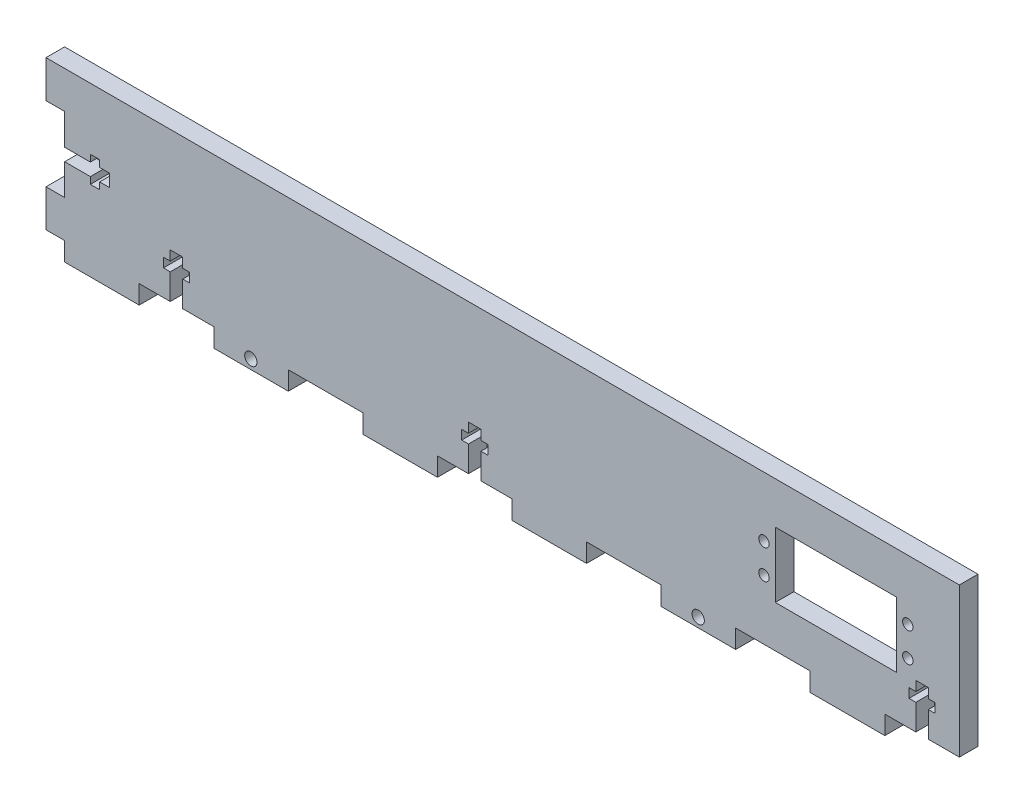
from build123d import *

# Parameters (mm, degrees)
SKETCH1_W           = 304.8
SKETCH1_H           = 50.8
BOSS_EXTRUDE1_DEPTH = 6.35
SKETCH2_W           = 41.275
SKETCH2_H           = 22.225
CUT_EXTRUDE1_DEPTH  = 265.034300402
SKETCH5_W           = 25.4
SKETCH5_H           = 6.35
BOSS_EXTRUDE2_DEPTH = 6.35
LPATTERN1_COUNT     = 6
LPATTERN1_PITCH     = 50.8
SKETCH6_W           = 6.35
SKETCH6_H           = 12.7
BOSS_EXTRUDE3_DEPTH = 6.35
LPATTERN2_COUNT     = 2
LPATTERN2_PITCH     = 38.1
CUT_EXTRUDE2_DEPTH  = 272.024068837
CUT_EXTRUDE3_DEPTH  = 272.024068837
SKETCH9_R           = 2.0955
CUT_EXTRUDE4_DEPTH  = 272.024068837
SKETCH10_R          = 1.778
CUT_EXTRUDE5_DEPTH  = 272.024068837


with BuildPart() as part:
    # Sketch1 → Boss-Extrude1 (new body)
    with BuildSketch(Plane.XY):
        with Locations((-110.333, 0)):
            Rectangle(SKETCH1_W, SKETCH1_H)
    extrude(amount=BOSS_EXTRUDE1_DEPTH)

    # Sketch2 → Cut-Extrude1 (cut, through all)
    with BuildSketch(Plane.XY.offset(6.35)):
        Rectangle(SKETCH2_W, SKETCH2_H)
    extrude(amount=-CUT_EXTRUDE1_DEPTH, mode=Mode.SUBTRACT)

    # Sketch5 → Boss-Extrude2 (add)
    with BuildSketch(Plane.XZ.offset(25.4)):
        with Locations((3.967, 3.175)):
            Rectangle(SKETCH5_W, SKETCH5_H)
    boss_extrude2 = extrude(amount=BOSS_EXTRUDE2_DEPTH)

    # LPattern1: Boss-Extrude2 ×6
    with Locations(*[(-i * LPATTERN1_PITCH, 0, 0) for i in range(1, LPATTERN1_COUNT)]):
        add(boss_extrude2)

    # Sketch6 → Boss-Extrude3 (add)
    with BuildSketch(Plane.ZY.offset(262.733)):
        with Locations((3.175, 19.05)):
            Rectangle(SKETCH6_W, SKETCH6_H)
    boss_extrude3 = extrude(amount=BOSS_EXTRUDE3_DEPTH)

    # LPattern2: Boss-Extrude3 ×2
    with Locations(*[(0, -i * LPATTERN2_PITCH, 0) for i in range(1, LPATTERN2_COUNT)]):
        add(boss_extrude3)

    # Sketch7 → Cut-Extrude2 (cut, through all)
    with BuildSketch(Plane.XY.offset(6.35)):
        Polygon((-262.733, 2.1336), (-262.733, -2.1336), (-253.97, -2.1336), (-253.97, -4.445), (-250.795, -4.445), (-250.795, -2.1336), (-247.493, -2.1336), (-247.493, 2.1336), (-250.795, 2.1336), (-250.795, 4.445), (-253.97, 4.445), (-253.97, 2.1336), align=None)
    extrude(amount=-CUT_EXTRUDE2_DEPTH, mode=Mode.SUBTRACT)

    # Sketch8 → Cut-Extrude3 (cut, through all)
    with BuildSketch(Plane.XY.offset(6.35)):
        Polygon((-226.7666, -25.4), (-222.4994, -25.4), (-222.4994, -16.637), (-220.188, -16.637), (-220.188, -13.462), (-222.4994, -13.462), (-222.4994, -10.16), (-226.7666, -10.16), (-226.7666, -13.462), (-229.078, -13.462), (-229.078, -16.637), (-226.7666, -16.637), align=None)
        Polygon((-125.1666, -25.4), (-120.8994, -25.4), (-120.8994, -16.637), (-118.588, -16.637), (-118.588, -13.462), (-120.8994, -13.462), (-120.8994, -10.16), (-125.1666, -10.16), (-125.1666, -13.462), (-127.478, -13.462), (-127.478, -16.637), (-125.1666, -16.637), align=None)
        Polygon((27.2334, -25.4), (31.5006, -25.4), (31.5006, -16.637), (33.812, -16.637), (33.812, -13.462), (31.5006, -13.462), (31.5006, -10.16), (27.2334, -10.16), (27.2334, -13.462), (24.922, -13.462), (24.922, -16.637), (27.2334, -16.637), align=None)
    extrude(amount=-CUT_EXTRUDE3_DEPTH, mode=Mode.SUBTRACT)

    # Sketch9 → Cut-Extrude4 (cut, through all)
    with BuildSketch(Plane(origin=(0, 0, 0), x_dir=(-1, 0, 0), z_dir=(0, 0, -1))):
        with Locations((46.904309807, -28.575)):
            Circle(SKETCH9_R)
        with Locations((199.304309807, -28.575)):
            Circle(SKETCH9_R)
    extrude(amount=-CUT_EXTRUDE4_DEPTH, mode=Mode.SUBTRACT)

    # Sketch10 → Cut-Extrude5 (cut, through all)
    with BuildSketch(Plane(origin=(0, 0, 0), x_dir=(-1, 0, 0), z_dir=(0, 0, -1))):
        with Locations((24.5, -5)):
            Circle(SKETCH10_R)
        with Locations((24.5, 5)):
            Circle(SKETCH10_R)
        with Locations((-24.5, -5)):
            Circle(SKETCH10_R)
        with Locations((-24.5, 5)):
            Circle(SKETCH10_R)
    extrude(amount=-CUT_EXTRUDE5_DEPTH, mode=Mode.SUBTRACT)


solid = part.part
